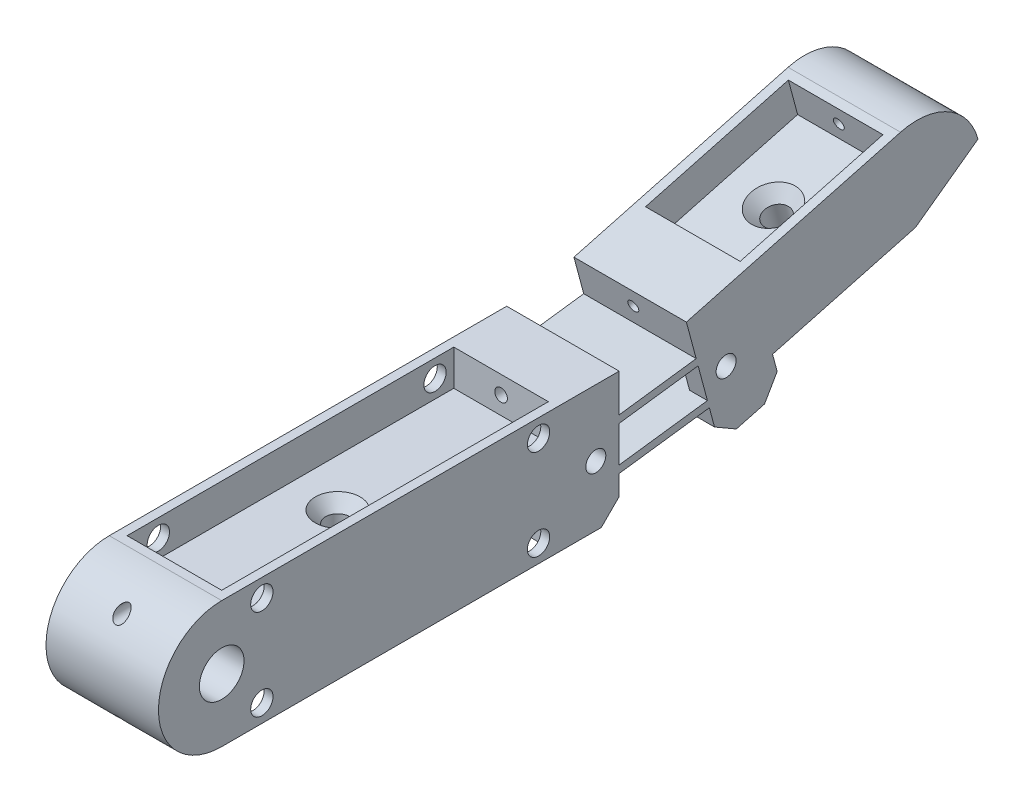
from build123d import *

# Parameters (mm, degrees)
SKETCH1_R                                      = 3.175
FINGER_FRAME_DEPTH                             = 8
SKETCH31_R                                     = 1.5875
F_1ST_DIGIT_DOWEL_PINS_DEPTH                   = 16
SKETCH32_W                                     = 13.46
SKETCH32_H                                     = 46.482
F_1ST_DIGIT_TOP_SURFACE_CUTAWAY_DEPTH          = 5.08
SKETCH33_W                                     = 13.46
SKETCH33_H                                     = 46.482
F_1ST_DIGIT_BOTTOM_SURFACE_CUTAWAY_DEPTH       = 5.08
SKETCH34_R                                     = 0.9
F_1ST_DIGIT_INLET_HOLE_DEPTH                   = 14.732
F_1ST_START                                    = -8.799330832
SKETCH35_R                                     = 0.9
F_1ST_DIGIT_OUTLET_HOLE_DEPTH                  = 8.799330832
F_1ST_DIGIT_INLET_HOLE_EXTENSOR_DEPTH          = 14.732
SKETCH37_R                                     = 0.762
F_1ST_DIGIT_OUTLET_HOLE_EXTENSOR_DEPTH         = 8.799330832
WAFFLE_AREA_DEPTH                              = 16
SKETCH52_W                                     = 13.46
SKETCH52_H                                     = 21.042139732
CUT_EXTRUDE12_DEPTH                            = 5.08
SKETCH53_W                                     = 13.46
SKETCH53_H                                     = 21.042139732
CUT_EXTRUDE13_DEPTH                            = 5.08
BOSS_EXTRUDE1_DEPTH                            = 16
CUT_EXTRUDE14_DEPTH                            = 16
CHAMFER2_SIZE                                  = 2.54
CSK_FOR_5_FLAT_HEAD_MACHINE_SCREW5_D           = 3.4544
CSK_FOR_5_FLAT_HEAD_MACHINE_SCREW5_CSINK_D     = 6.4008
CSK_FOR_5_FLAT_HEAD_MACHINE_SCREW5_CSINK_ANGLE = 82
CSK_FOR_5_FLAT_HEAD_MACHINE_SCREW6_D           = 3.4544
CSK_FOR_5_FLAT_HEAD_MACHINE_SCREW6_CSINK_D     = 6.4008
CSK_FOR_5_FLAT_HEAD_MACHINE_SCREW6_CSINK_ANGLE = 82
BOSS_EXTRUDE2_DEPTH                            = 2.54
BOSS_EXTRUDE3_DEPTH                            = 2.54
CUT_EXTRUDE15_START                            = -16
SKETCH64_R                                     = 1.4224
CUT_EXTRUDE15_DEPTH                            = 16


with BuildPart() as part:
    # Sketch1 → Finger Frame (new, symmetric)
    with BuildSketch(Plane(origin=(0, 0, 0), x_dir=(0, 0, -1), z_dir=(1, 0, 0))):
        with BuildLine():
            Line((56.551330832, 3.614995505), (67.513039484, 5.058131827))
            Line((67.513039484, 5.058131827), (66.119297762, 10.259646743))
            Line((66.119297762, 10.259646743), (96.587643055, 18.423615259))
            Line((96.587643055, 18.423615259), (101.246385867, 1.036950386))
            Line((101.246385867, 1.036950386), (70.778040574, -7.12701813))
            Line((70.778040574, -7.12701813), (69.384298853, -1.925503214))
            Line((69.384298853, -1.925503214), (56.551330832, -3.614995505))
            Line((56.551330832, -3.614995505), (56.551330832, -9))
            Line((56.551330832, -9), (0, -9))
            ThreePointArc((0, -9), (-9, 0), (0, 9))
            Line((0, 9), (56.551330832, 9))
            Line((56.551330832, 9), (56.551330832, 3.614995505))
        make_face()
        Circle(SKETCH1_R, mode=Mode.SUBTRACT)
    extrude(amount=FINGER_FRAME_DEPTH, both=True)

    # Sketch31 → 1st Digit Dowel Pins (cut)
    with BuildSketch(Plane(origin=(8, 0, 0), x_dir=(0, 0, -1), z_dir=(1, 0, 0))):
        with Locations((5.715, 6.46)):
            Circle(SKETCH31_R)
        with Locations((45.085, 6.46)):
            Circle(SKETCH31_R)
        with Locations((45.085, -6.46)):
            Circle(SKETCH31_R)
        with Locations((5.715, -6.46)):
            Circle(SKETCH31_R)
    extrude(amount=-F_1ST_DIGIT_DOWEL_PINS_DEPTH, mode=Mode.SUBTRACT)

    # Sketch32 → 1st Digit Top Surface Cutaway (cut)
    with BuildSketch(Plane(origin=(0, 9, 0), x_dir=(1, 0, 0), z_dir=(0, 1, 0))):
        with Locations((0, 24.511)):
            Rectangle(SKETCH32_W, SKETCH32_H)
    extrude(amount=-F_1ST_DIGIT_TOP_SURFACE_CUTAWAY_DEPTH, mode=Mode.SUBTRACT)

    # Sketch33 → 1st Digit Bottom Surface Cutaway (cut)
    with BuildSketch(Plane.XZ.offset(9)):
        with Locations((0, -24.511)):
            Rectangle(SKETCH33_W, SKETCH33_H)
    extrude(amount=-F_1ST_DIGIT_BOTTOM_SURFACE_CUTAWAY_DEPTH, mode=Mode.SUBTRACT)

    # Sketch34 → 1st Digit Inlet Hole (cut)
    with BuildSketch(Plane(origin=(0, 0, -1.27), x_dir=(-1, 0, 0), z_dir=(0, 0, -1))):
        with Locations(Location((0, 6.46, 0), (0, 0, 90))):
            Circle(SKETCH34_R)
    extrude(amount=-F_1ST_DIGIT_INLET_HOLE_DEPTH, mode=Mode.SUBTRACT)

    # Sketch35 → 1st Digit Outlet Hole (cut)
    with BuildSketch(Plane.XY.offset(-47.752).offset(F_1ST_START)):
        with Locations(Location((0, 6.46, 0), (0, 0, 90))):
            Circle(SKETCH35_R)
    extrude(amount=F_1ST_DIGIT_OUTLET_HOLE_DEPTH, mode=Mode.SUBTRACT)

    # Sketch36 → 1st Digit Inlet Hole Extensor (cut)
    with BuildSketch(Plane(origin=(0, 0, -1.27), x_dir=(-1, 0, 0), z_dir=(0, 0, -1))):
        with BuildLine():
            ThreePointArc((0, -5.698), (-0.762, -6.46), (0, -7.222))
            Line((0, -7.222), (0, -5.698))
        make_face()
        with BuildLine():
            Line((0, -5.698), (0, -7.222))
            ThreePointArc((0, -7.222), (0.538815367, -6.998815367), (0.762, -6.46))
            ThreePointArc((0.762, -6.46), (0.538815367, -5.921184633), (0, -5.698))
        make_face()
    extrude(amount=-F_1ST_DIGIT_INLET_HOLE_EXTENSOR_DEPTH, mode=Mode.SUBTRACT)

    # Sketch37 → 1st Digit Outlet Hole Extensor (cut)
    with BuildSketch(Plane.XY.offset(-47.752).offset(F_1ST_START)):
        with Locations(Location((0, -6.46, 0), (0, 0, 90))):
            Circle(SKETCH37_R)
    extrude(amount=F_1ST_DIGIT_OUTLET_HOLE_EXTENSOR_DEPTH, mode=Mode.SUBTRACT)

    # Sketch38 → Waffle Area (cut)
    with BuildSketch(Plane(origin=(8, 0, 0), x_dir=(0, 0, -1), z_dir=(1, 0, 0))):
        Polygon((74.759813211, 4.959109742), (49.577113732, 1.64374446), (50.240186789, -3.392795436), (75.422886268, -0.077430153), align=None)
    extrude(amount=-WAFFLE_AREA_DEPTH, mode=Mode.SUBTRACT)

    # Cut-Loft1: read off the stored shape, not the designer's step
    # Cut-Loft1: loft between two sections, ruled curve by curve
    cut_loft1_from = [
        Edge.make_bspline([(-0.742798257, 8.314462866, -66.640508211), (0.377283736, 9.312686492, -66.373034997), (1.410720879, 8.230770367, -66.662933549), (0.290638886, 7.232546741, -66.930406763), (-0.829443108, 6.234323115, -67.197879978), (-1.86288025, 7.31623924, -66.907981426), (-0.742798257, 8.314462866, -66.640508211)], [0, 0, 0, 0, 0.5, 0.5, 0.5, 1, 1, 1, 1], 3, [1, 0.333333333, 0.333333333, 1, 0.333333333, 0.333333333, 1]),
    ]
    cut_loft1_to = [
        Edge.make_bspline([(-0.886548909, 16.30455615, -97.155443232), (-0.126484689, 17.580484711, -96.813559205), (1.194453758, 16.84631905, -97.010278301), (0.434389538, 15.570390489, -97.352162328), (-0.325674683, 14.294461929, -97.694046356), (-1.64661313, 15.028627589, -97.49732726), (-0.886548909, 16.30455615, -97.155443232)], [0, 0, 0, 0, 0.5, 0.5, 0.5, 1, 1, 1, 1], 3, [1, 0.333333333, 0.333333333, 1, 0.333333333, 0.333333333, 1]),
    ]
    cut_loft1 = Solid(Shell([*[Face.make_surface_from_curves(cut_loft1_from[k], cut_loft1_to[k]) for k in range(1)], Face(Wire(cut_loft1_from)), Face(Wire(cut_loft1_to))]))
    add(cut_loft1, mode=Mode.SUBTRACT)

    # Sketch52 → Cut-Extrude12 (cut)
    with BuildSketch(Plane(origin=(0, -6.957443712, -1.864241424), x_dir=(1, 0, 0), z_dir=(0, 0.9659258262890682, 0.25881904510252135))):
        with Locations((0, 86.27381157)):
            Rectangle(SKETCH52_W, SKETCH52_H)
    extrude(amount=-CUT_EXTRUDE12_DEPTH, mode=Mode.SUBTRACT)

    # Sketch53 → Cut-Extrude13 (cut)
    with BuildSketch(Plane(origin=(0, -24.344108585, -6.522984236), x_dir=(1, 0, 0), z_dir=(0, -0.9659258262890681, -0.25881904510252135))):
        with Locations((0, -86.27381157)):
            Rectangle(SKETCH53_W, SKETCH53_H)
    extrude(amount=-CUT_EXTRUDE13_DEPTH, mode=Mode.SUBTRACT)

    # Cut-Loft2: read off the stored shape, not the designer's step
    # Cut-Loft2: loft between two sections, ruled curve by curve
    cut_loft2_from = [
        Edge.make_bspline([(0.722453651, 3.871742568, -100.486805591), (0.237872501, 5.267415847, -100.112836063), (-1.207034801, 4.799346399, -100.238254894), (-0.722453651, 3.40367312, -100.612224422), (-0.237872501, 2.007999841, -100.98619395), (1.207034801, 2.476069289, -100.860775119), (0.722453651, 3.871742568, -100.486805591)], [0, 0, 0, 0, 0.5, 0.5, 0.5, 1, 1, 1, 1], 3, [1, 0.333333333, 0.333333333, 1, 0.333333333, 0.333333333, 1]),
    ]
    cut_loft2_to = [
        Edge.make_bspline([(0.727321774, -4.745776824, -70.139988889), (1.181841462, -3.340699053, -69.763499435), (-0.272802087, -2.901666748, -69.645861084), (-0.727321774, -4.306744519, -70.022350538), (-1.181841462, -5.711822291, -70.398839992), (0.272802087, -6.150854596, -70.516478344), (0.727321774, -4.745776824, -70.139988889)], [0, 0, 0, 0, 0.5, 0.5, 0.5, 1, 1, 1, 1], 3, [1, 0.333333333, 0.333333333, 1, 0.333333333, 0.333333333, 1]),
    ]
    cut_loft2 = Solid(Shell([*[Face.make_surface_from_curves(cut_loft2_from[k], cut_loft2_to[k]) for k in range(1)], Face(Wire(cut_loft2_from)), Face(Wire(cut_loft2_to))]))
    add(cut_loft2, mode=Mode.SUBTRACT)

    # Cut-Loft2 2: loft between two sections, ruled curve by curve
    cut_loft2_2_from = [
        Edge.make_bspline([(0.722453651, 3.871742568, -100.486805591), (0.237872501, 5.267415847, -100.112836063), (-1.207034801, 4.799346399, -100.238254894), (-0.722453651, 3.40367312, -100.612224422), (-0.237872501, 2.007999841, -100.98619395), (1.207034801, 2.476069289, -100.860775119), (0.722453651, 3.871742568, -100.486805591)], [0, 0, 0, 0, 0.5, 0.5, 0.5, 1, 1, 1, 1], 3, [1, 0.333333333, 0.333333333, 1, 0.333333333, 0.333333333, 1]),
    ]
    cut_loft2_2_to = [
        Edge.make_bspline([(0.727321774, -4.745776824, -70.139988889), (1.181841462, -3.340699053, -69.763499435), (-0.272802087, -2.901666748, -69.645861084), (-0.727321774, -4.306744519, -70.022350538), (-1.181841462, -5.711822291, -70.398839992), (0.272802087, -6.150854596, -70.516478344), (0.727321774, -4.745776824, -70.139988889)], [0, 0, 0, 0, 0.5, 0.5, 0.5, 1, 1, 1, 1], 3, [1, 0.333333333, 0.333333333, 1, 0.333333333, 0.333333333, 1]),
    ]
    cut_loft2_2 = Solid(Shell([*[Face.make_surface_from_curves(cut_loft2_2_from[k], cut_loft2_2_to[k]) for k in range(1)], Face(Wire(cut_loft2_2_from)), Face(Wire(cut_loft2_2_to))]))
    add(cut_loft2_2, mode=Mode.SUBTRACT)

    # Sketch56 → Boss-Extrude1 (add)
    with BuildSketch(Plane(origin=(8, 0, 0), x_dir=(0, 0, -1), z_dir=(1, 0, 0))):
        with BuildLine():
            Line((96.587643055, 18.423615259), (101.246385867, 1.036950386))
            ThreePointArc((101.246385867, 1.036950386), (107.610346898, 12.059654228), (96.587643055, 18.423615259))
        make_face()
    extrude(amount=-BOSS_EXTRUDE1_DEPTH)

    # Sketch57 → Cut-Extrude14 (cut)
    with BuildSketch(Plane(origin=(8, 0, 0), x_dir=(0, 0, -1), z_dir=(1, 0, 0))):
        with BuildLine():
            Line((78.379713111, 0.169046884), (79.69451386, -4.737856314))
            Line((79.69451386, -4.737856314), (101.246385867, 1.036950386))
            ThreePointArc((101.246385867, 1.036950386), (106.711243095, 5.230282823), (107.610346898, 12.059654228))
            Line((107.610346898, 12.059654228), (98.704859318, 5.615153396))
            Line((98.704859318, 5.615153396), (78.379713111, 0.169046884))
        make_face()
    extrude(amount=-CUT_EXTRUDE14_DEPTH, mode=Mode.SUBTRACT)

    # Chamfer2
    # the kernel refuses this chamfer: 2.54 mm, written as the material it takes off along each edge
    with BuildSketch(Plane(origin=(-14.532074789, -4.737856314, -79.69451386), x_dir=(0, 0.9659258262890676, 0.25881904510252346), z_dir=(1, 0, 0))) as chamfer2_piece_1:
        Polygon((CHAMFER2_SIZE, 0), (0, CHAMFER2_SIZE), (0, 0), align=None)
    extrude(amount=29.064149579, mode=Mode.SUBTRACT)
    with BuildSketch(Plane(origin=(14.532074789, -7.12701813, -70.778040574), x_dir=(0, 0.25881904510252146, -0.9659258262890681), z_dir=(-1, 0, 0)), Plane(origin=(14.532074789, -9, -56.551330832), x_dir=(0, 1, 0), z_dir=(-1, 0, 0))) as chamfer2_piece_2:
        Polygon((CHAMFER2_SIZE, 0), (0, -CHAMFER2_SIZE), (0, 0), align=None)
    extrude(amount=29.064149579, mode=Mode.SUBTRACT)

    # CSK for #5 Flat Head Machine Screw5 (through all)
    with Locations(Plane(origin=(0, 3.92, 0), x_dir=(1, 0, 0), z_dir=(0, 1, 0))):
        with Locations((0, 24.511)):
            CounterSinkHole(CSK_FOR_5_FLAT_HEAD_MACHINE_SCREW5_D / 2, CSK_FOR_5_FLAT_HEAD_MACHINE_SCREW5_CSINK_D / 2, counter_sink_angle=CSK_FOR_5_FLAT_HEAD_MACHINE_SCREW5_CSINK_ANGLE)

    # CSK for #5 Flat Head Machine Screw6 (through all)
    with Locations(Plane(origin=(0, -11.86434691, -3.179042173), x_dir=(1, 0, 0), z_dir=(0, 0.9659258262890682, 0.25881904510252124))):
        with Locations((0, 86.27381157)):
            CounterSinkHole(CSK_FOR_5_FLAT_HEAD_MACHINE_SCREW6_D / 2, CSK_FOR_5_FLAT_HEAD_MACHINE_SCREW6_CSINK_D / 2, counter_sink_angle=CSK_FOR_5_FLAT_HEAD_MACHINE_SCREW6_CSINK_ANGLE)

    # Sketch62 → Boss-Extrude2 (add)
    with BuildSketch(Plane(origin=(8, 0, 0), x_dir=(0, 0, -1), z_dir=(1, 0, 0))):
        Polygon((56.551330832, 2.56191756), (56.551330832, -2.56191756), (50.240186789, -3.392795436), (49.577113732, 1.64374446), align=None)
        Polygon((67.785596112, 4.040936643), (69.111742225, -0.908308029), (75.422886268, -0.077430153), (74.759813211, 4.959109742), align=None)
    extrude(amount=-BOSS_EXTRUDE2_DEPTH)

    # Sketch63 → Boss-Extrude3 (add)
    with BuildSketch(Plane.ZY.offset(8)):
        Polygon((-75.422886268, -0.077430153), (-74.759813211, 4.959109742), (-67.785596112, 4.040936643), (-69.111742225, -0.908308029), align=None)
        Polygon((-56.551330832, -2.56191756), (-56.551330832, 2.56191756), (-49.577113732, 1.64374446), (-50.240186789, -3.392795436), align=None)
    extrude(amount=-BOSS_EXTRUDE3_DEPTH)

    # Sketch64 → Cut-Extrude15 (cut)
    with BuildSketch(Plane(origin=(8, 0, 0), x_dir=(0, 0, -1), z_dir=(1, 0, 0)).offset(CUT_EXTRUDE15_START)):
        with Locations((71.770009454, 2.003577051)):
            Circle(SKETCH64_R)
        with Locations((53.229990546, -0.437262744)):
            Circle(SKETCH64_R)
    extrude(amount=CUT_EXTRUDE15_DEPTH, mode=Mode.SUBTRACT)


solid = part.part
